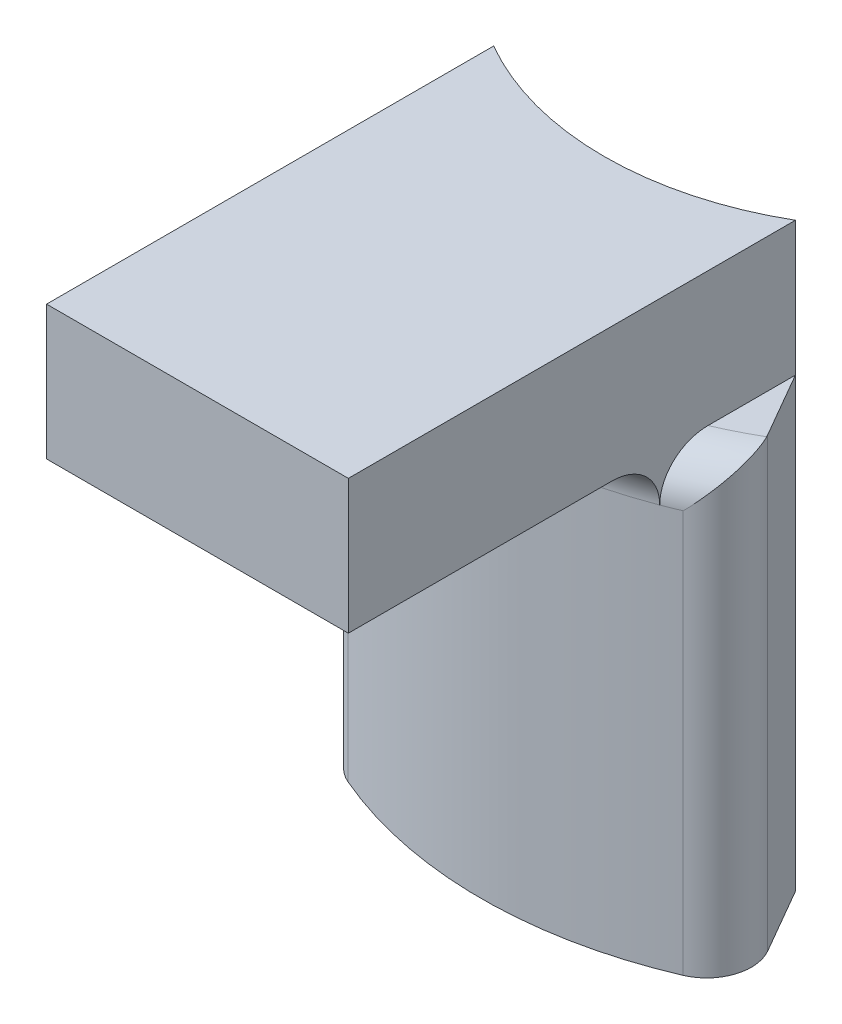
from build123d import *

# Parameters (mm, degrees)
BOSS_EXTRUDE1_DEPTH = 10
BOSS_EXTRUDE2_DEPTH = 3
FILLET1_R           = 1
FILLET2_R           = 1
FILLET3_R           = 1
FILLET4_R           = 1


with BuildPart() as part:
    # Sketch1 → Boss-Extrude1 (new body)
    with BuildSketch(Plane(origin=(0, 0, 0), x_dir=(1, 0, 0), z_dir=(0, 1, 0))):
        with BuildLine():
            ThreePointArc((4.75, -8.227241336), (0, -9.5), (-4.75, -8.227241336))
            Line((-4.75, -8.227241336), (-3.375, -5.845671476))
            ThreePointArc((-3.375, -5.845671476), (0, -6.75), (3.375, -5.845671476))
            Line((3.375, -5.845671476), (4.75, -8.227241336))
        make_face()
    extrude(amount=BOSS_EXTRUDE1_DEPTH)

    # Sketch2 → Boss-Extrude2 (add)
    with BuildSketch(Plane(origin=(0, 10, 0), x_dir=(1, 0, 0), z_dir=(0, 1, 0))):
        with BuildLine():
            Line((-3.375, -5.845671476), (-3.375, -15.845671476))
            Line((-3.375, -15.845671476), (3.375, -15.845671476))
            Line((3.375, -15.845671476), (3.375, -5.845671476))
            ThreePointArc((3.375, -5.845671476), (0, -6.75), (-3.375, -5.845671476))
        make_face()
    extrude(amount=BOSS_EXTRUDE2_DEPTH)

    # Fillet1
    fillet1_edges = [part.edges().sort_by_distance(p)[0] for p in [
        (0, 10, 9.5),
    ]]
    fillet(fillet1_edges, radius=FILLET1_R)

    # Fillet2
    fillet2_edges = [part.edges().sort_by_distance(p)[0] for p in [
        (-4.075600712, 10, 8.581344815),
    ]]
    fillet(fillet2_edges, radius=FILLET2_R)

    # Fillet3
    # the kernel refuses this fillet: 1 mm, written as the material it takes off along each edge
    with BuildSketch(Plane(origin=(-4.75, -2.798981274, 8.227241336), x_dir=(0.893983522608317, 0, 0.44809983408256804), z_dir=(0, 1, 0))) as fillet3_piece_1:
        with BuildLine():
            CenterArc((1.060666588, 0.998262358), FILLET3_R, 176.621836485, 96.756327031)
            Line((0.06240423, 1.05718828), (0, 0))
            ThreePointArc((0, 0), (0.559796255, -0.016507597), (1.11959251, 0))
        make_face()
    extrude(amount=14.597962548, mode=Mode.SUBTRACT)
    with BuildSketch(Plane(origin=(0, 10, 0), x_dir=(0.7080675160533174, 0, 0.706144739207257), z_dir=(0.706144739207257, 0, -0.7080675160533174))) as fillet3_piece_2_section:
        with BuildLine():
            CenterArc((9.5 - FILLET3_R, FILLET3_R), FILLET3_R, 270, 90)
            Line((9.5 - FILLET3_R, 0), (9.5, 0))
            Line((9.5, 0), (9.5, FILLET3_R))
        make_face()
    fillet3_piece_2 = revolve(axis=Axis((0, 10, 0), (0, -1, 0)), revolution_arc=39.346226133, mode=Mode.PRIVATE)
    fillet3_piece_2 = split(fillet3_piece_2, bisect_by=Plane(origin=(3.375, 9.768637129, 8.366507066), z_dir=(1, 0, 0)), keep=Keep.TOP, mode=Mode.PRIVATE)
    add(fillet3_piece_2, mode=Mode.SUBTRACT)

    # Fillet4
    # the kernel refuses this fillet: 1 mm, written as the material it takes off along each edge
    with BuildSketch(Plane(origin=(4.75, -2.798981274, 8.227241336), x_dir=(-0.8939835226083171, 0, 0.44809983408256765), z_dir=(0, 1, 0))) as fillet4_piece_1:
        with BuildLine():
            CenterArc((1.060666588, -0.998262358), FILLET4_R, 86.621836485, 96.756327031)
            Line((0.06240423, -1.05718828), (0, 0))
            ThreePointArc((0, 0), (0.559796255, 0.016507597), (1.11959251, 0))
        make_face()
    extrude(amount=14.597962548, mode=Mode.SUBTRACT)


solid = part.part
